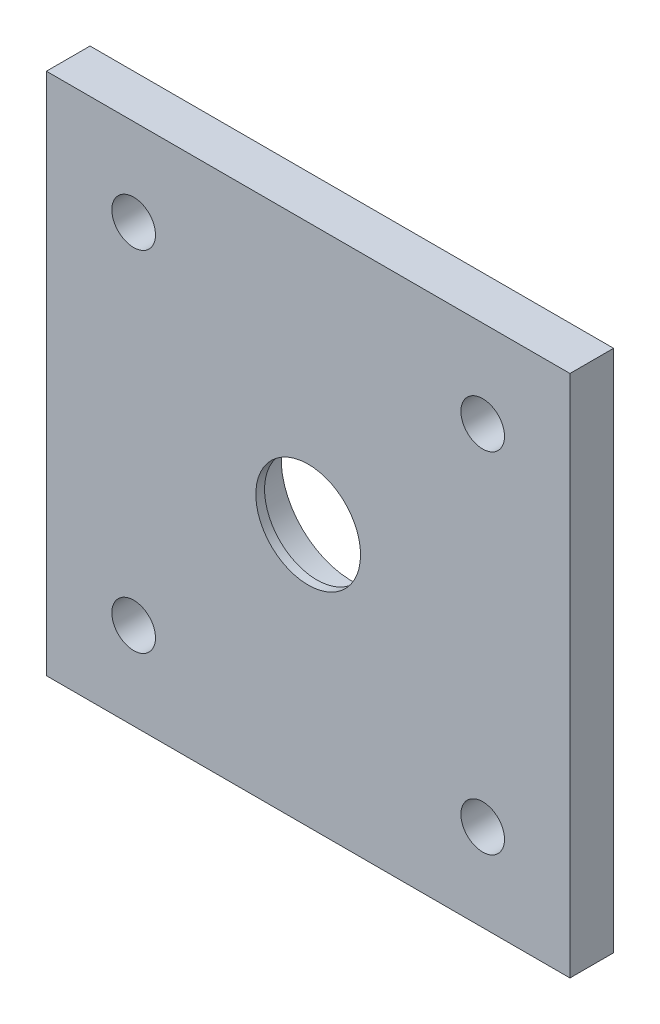
from build123d import *

# Parameters (mm, degrees)
SKETCH2_W                = 76.2
SKETCH2_H                = 76.2
SKETCH2_R                = 7.62
BOSS_EXTRUDE1_DEPTH      = 6.35
CUT_EXTRUDE5_OUTLINE_R   = 10.287
CUT_EXTRUDE5_OUTLINE_R_2 = 7.62
CUT_EXTRUDE5_DEPTH       = 5.08
SKETCH6_R                = 3.175
CUT_EXTRUDE6_DEPTH       = 55.254423783


# Read off the part's stored shape, not the designer's step: Cut-Extrude5
with BuildPart() as part:
    # Sketch2 → Boss-Extrude1 (new body)
    with BuildSketch(Plane.XY):
        Rectangle(SKETCH2_W, SKETCH2_H)
        Circle(SKETCH2_R, mode=Mode.SUBTRACT)
    extrude(amount=BOSS_EXTRUDE1_DEPTH)

    # Cut-Extrude5 outline → Cut-Extrude5 (cut)
    with BuildSketch(Plane.XY):
        Circle(CUT_EXTRUDE5_OUTLINE_R)
        Circle(CUT_EXTRUDE5_OUTLINE_R_2, mode=Mode.SUBTRACT)
    extrude(amount=CUT_EXTRUDE5_DEPTH, mode=Mode.SUBTRACT)

    # Sketch6 → Cut-Extrude6 (cut, through all)
    with BuildSketch(Plane.XY.offset(6.35)):
        with Locations((-25.4, 25.4)):
            Circle(SKETCH6_R)
        with Locations((25.4, 25.4)):
            Circle(SKETCH6_R)
        with Locations((25.4, -25.4)):
            Circle(SKETCH6_R)
        with Locations((-25.4, -25.4)):
            Circle(SKETCH6_R)
    extrude(amount=-CUT_EXTRUDE6_DEPTH, mode=Mode.SUBTRACT)


solid = part.part
